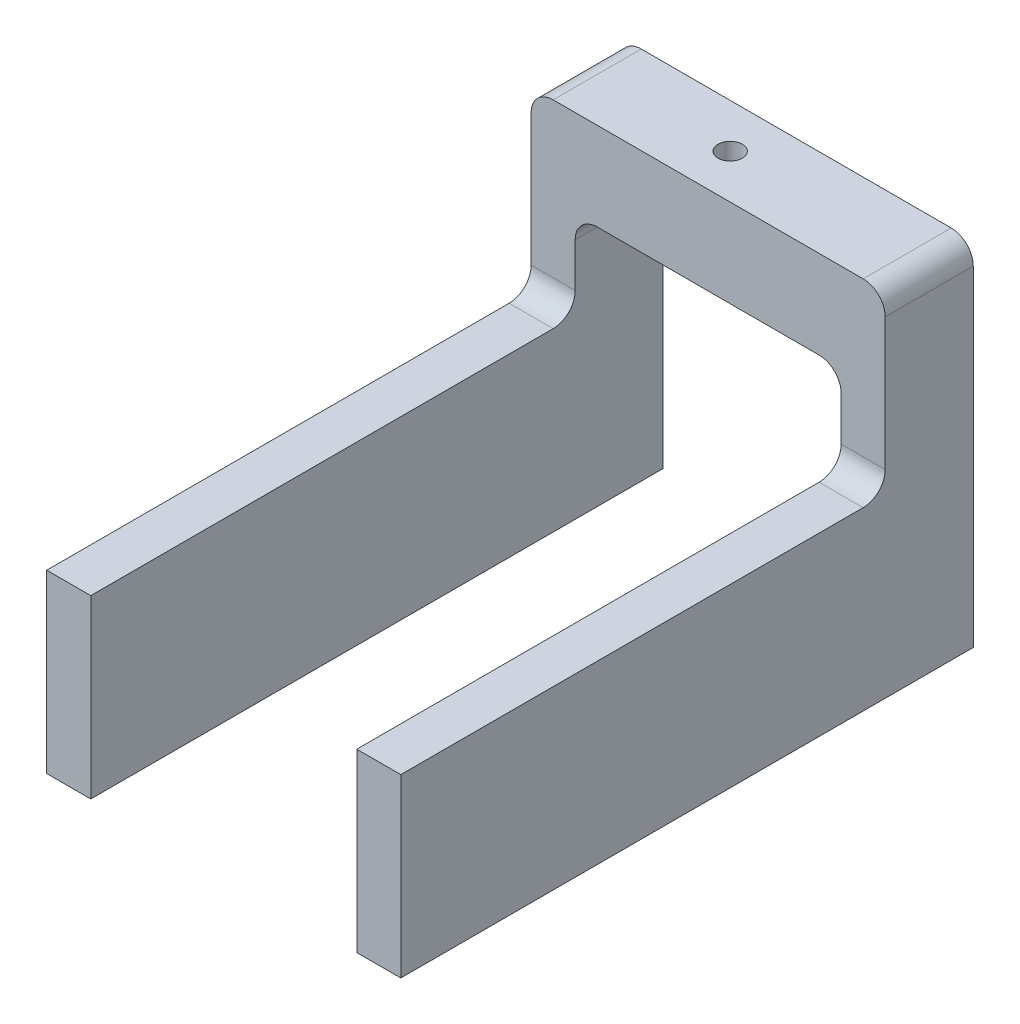
from build123d import *

# Parameters (mm, degrees)
BOSS_EXTRUDE1_DEPTH   = 102.108
SKETCH2_W             = 76.708
SKETCH2_H             = 76.2
CUT_EXTRUDE1_DEPTH    = 220.104116036
F_7_0MM_DOWEL_HOLE1_D = 7
FILLET1_R             = 6.35


with BuildPart() as part:
    # Sketch1 → Boss-Extrude1 (new body)
    with BuildSketch(Plane(origin=(0, 0, 0), x_dir=(0, 0, -1), z_dir=(1, 0, 0))):
        Polygon((0, 0), (-165.1, 0), (-165.1, 50.8), (-25.4, 50.8), (-25.4, 101.6), (0, 101.6), align=None)
    extrude(amount=BOSS_EXTRUDE1_DEPTH)

    # Sketch2 → Cut-Extrude1 (cut, through all)
    with BuildSketch(Plane(origin=(0, 0, 0), x_dir=(-1, 0, 0), z_dir=(0, 0, -1))):
        with Locations((-51.054, 38.1)):
            Rectangle(SKETCH2_W, SKETCH2_H)
    extrude(amount=-CUT_EXTRUDE1_DEPTH, mode=Mode.SUBTRACT)

    # Ø7.0mm Dowel Hole1 (through all)
    with Locations(Plane(origin=(0, 101.6, 0), x_dir=(1, 0, 0), z_dir=(0, 1, 0))):
        with Locations((44.704, -12.7)):
            Hole(F_7_0MM_DOWEL_HOLE1_D / 2)

    # Fillet1
    fillet1_edges = [part.edges().sort_by_distance(p)[0] for p in [
        (89.408, 76.2, 12.7),
        (12.7, 76.2, 12.7),
        (6.35, 50.8, 25.4),
        (95.758, 50.8, 25.4),
        (102.108, 101.6, 12.7),
        (0, 101.6, 12.7),
    ]]
    fillet(fillet1_edges, radius=FILLET1_R)


solid = part.part
